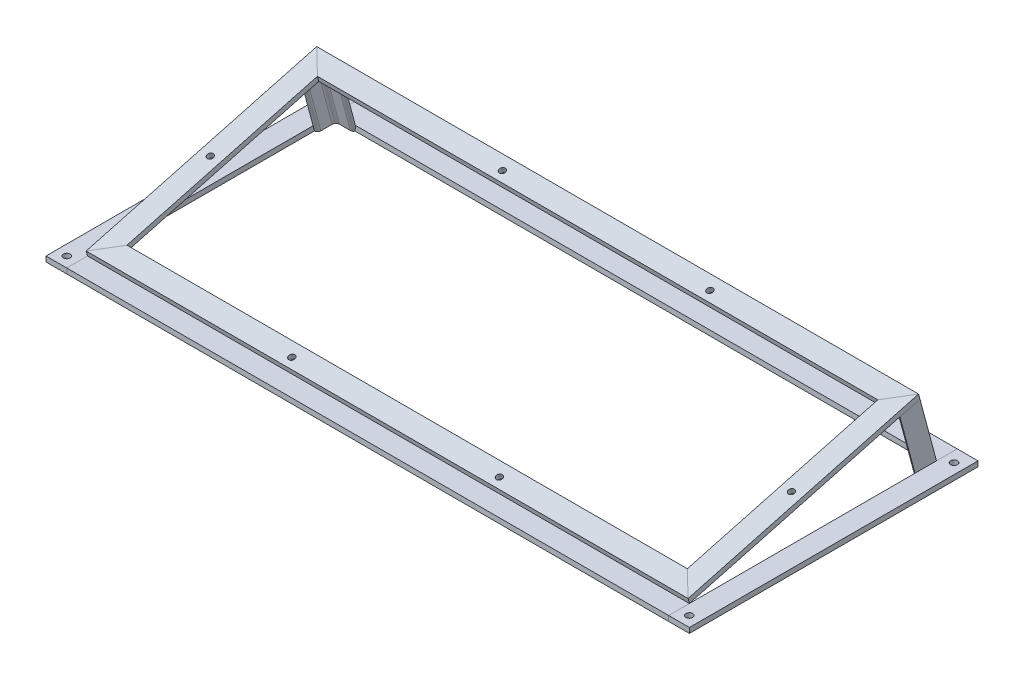
from build123d import *

# Parameters (mm, degrees)
TUBE_RECTANGULAR_50_X_30_X_2_6_46_DEPTH      = 251.615528128
TUBE_RECTANGULAR_50_X_30_X_2_6_46_DEPTH_BACK = 21.615528128
SKETCH1_W                                    = 20
SKETCH1_H                                    = 5
SKETCH1_ON_SEGMENT_2_W                       = 20
SKETCH1_ON_SEGMENT_2_H                       = 5
TUBE_RECTANGULAR_50_X_30_X_2_6_46_3_DEPTH    = 623.231056256
SKETCH1_ON_SEGMENT_3_W                       = 20
SKETCH1_ON_SEGMENT_3_H                       = 5
TUBE_RECTANGULAR_50_X_30_X_2_6_46_5_DEPTH    = 273.231056256
SKETCH1_ON_SEGMENT_4_W                       = 20
SKETCH1_ON_SEGMENT_4_H                       = 5
TUBE_RECTANGULAR_50_X_30_X_2_6_46_7_DEPTH    = 623.231056256
L_ANGLE_EQUAL_20X20X3_13_DEPTH               = 61.628314259
L_ANGLE_EQUAL_20X20X3_13_2_DEPTH             = 61.628314259
TUBE_START                                   = -5
TUBE_RECTANGULAR_50_X_30_X_2_6_47_OUTL_W     = 20
TUBE_RECTANGULAR_50_X_30_X_2_6_47_OUTL_H     = 278.113521494
TUBE_RECTANGULAR_50_X_30_X_2_6_47_DEPTH      = 5
TUBE_START_2                                 = -290
TUBE_RECTANGULAR_50_X_30_X_2_6_47_2_OU_W     = 5
TUBE_RECTANGULAR_50_X_30_X_2_6_47_2_OU_H     = 20
TUBE_RECTANGULAR_50_X_30_X_2_6_47_2_DEPTH    = 580
TUBE_RECTANGULAR_50_X_30_X_2_6_47_3_OU_W     = 5
TUBE_RECTANGULAR_50_X_30_X_2_6_47_3_OU_H     = 20
TUBE_RECTANGULAR_50_X_30_X_2_6_47_3_DEPTH    = 580
TUBE_RECTANGULAR_50_X_30_X_2_6_47_4_OU_W     = 20
TUBE_RECTANGULAR_50_X_30_X_2_6_47_4_OU_H     = 278.113521494
TUBE_RECTANGULAR_50_X_30_X_2_6_47_4_DEPTH    = 5
BODY_START                                   = 61.628314241
BODY_5_RUN_ON_DEPTH                          = 5.176381
BODY_START_2                                 = 61.62831424
BODY_6_RUN_ON_DEPTH                          = 5.176381
SKETCH20_W                                   = 3.3
SKETCH20_H                                   = 5
M6_CLEARANCE_HOLE1_AT_2_COUNT                = 2
M6_CLEARANCE_HOLE1_AT_2_PITCH                = 255
M6_CLEARANCE_HOLE1_AT_3_COUNT                = 2
M6_CLEARANCE_HOLE1_AT_3_PITCH                = 651.939414363
M6_CLEARANCE_HOLE1_AT_4_COUNT                = 2
M6_CLEARANCE_HOLE1_AT_4_PITCH                = 600
ESQUISSE2_W                                  = 2.9
ESQUISSE2_H                                  = 76.634324293
D_GAGEMENT_M51_AT_2_COUNT                    = 2
D_GAGEMENT_M51_AT_2_PITCH                    = 290
D_GAGEMENT_M51_AT_3_COUNT                    = 2
D_GAGEMENT_M51_AT_3_PITCH                    = 210
D_GAGEMENT_M51_AT_4_COUNT                    = 2
D_GAGEMENT_M51_AT_4_PITCH                    = 208.386659842
D_GAGEMENT_M51_AT_5_COUNT                    = 2
D_GAGEMENT_M51_AT_5_PITCH                    = 394.239774756
D_GAGEMENT_M51_AT_6_COUNT                    = 2
D_GAGEMENT_M51_AT_6_PITCH                    = 200


# Read off the part's stored shape, not the designer's step: Tube (rectangular) 50 X 30 X 2.6(47)
with BuildPart() as part:
    # Sketch1 → Tube (rectangular) 50 X 30 X 2.6(46) (new, two sides: drawn at the far end of the back side and taken through both)
    with BuildSketch(Plane(origin=(-280, 2.414814566, 119.70380836), x_dir=(1, 0, 0), z_dir=(1.2067641572012591e-15, 0.25881904510252146, -0.9659258262890681)).offset(-TUBE_RECTANGULAR_50_X_30_X_2_6_46_DEPTH_BACK)):
        Rectangle(SKETCH1_W, SKETCH1_H)
    extrude(amount=TUBE_RECTANGULAR_50_X_30_X_2_6_46_DEPTH + TUBE_RECTANGULAR_50_X_30_X_2_6_46_DEPTH_BACK)

    # Tube (rectangular) 50 X 30 X 2.6(46) mitr
    split(bisect_by=Plane(origin=(-290, 0, 119.056760747), x_dir=(-0.250562807, -0.968100346, 0), z_dir=(-0.707106781, 0.183012702, -0.683012702)), keep=Keep.TOP)

    # Tube (rectangular) 50 X 30 X 2.6(46)  2
    split(bisect_by=Plane(origin=(-290, 59.528380374, -103.106179299), x_dir=(0.250562807, -0.968100346, 0), z_dir=(-0.707106781, -0.183012702, 0.683012702)), keep=Keep.TOP)


with BuildPart() as body_2:
    # Sketch1 on segment 2 (carried to segment 2) → Tube (rectangular) 50 X 30 X 2.6(46)  3 (new body)
    with BuildSketch(Plane(origin=(-311.615528128, 59.355004488, -92.799873424), x_dir=(0, -0.258819045, 0.965925826), z_dir=(1, 0, 0))):
        Rectangle(SKETCH1_ON_SEGMENT_2_W, SKETCH1_ON_SEGMENT_2_H)
    extrude(amount=TUBE_RECTANGULAR_50_X_30_X_2_6_46_3_DEPTH)

    # Tube _rectangular_ 50 X 30 X 2.6_46 3 mi
    split(bisect_by=Plane(origin=(-290, 59.528380374, -103.106179299), x_dir=(-0.250562807, 0.968100346, 0), z_dir=(0.707106781, 0.183012702, -0.683012702)), keep=Keep.TOP)

    # Tube (rectangular) 50 X 30 X 2.6(46)  4
    split(bisect_by=Plane(origin=(290, 59.528380374, -103.106179299), x_dir=(-0.250562807, -0.968100346, 0), z_dir=(-0.707106781, 0.183012702, -0.683012702)), keep=Keep.TOP)


with BuildPart() as body_3:
    # Sketch1 on segment 3 (carried to segment 3) → Tube (rectangular) 50 X 30 X 2.6(46)  5 (new body)
    with BuildSketch(Plane(origin=(280, 67.537705289, -123.338128554), x_dir=(-1, 0, 0), z_dir=(0, -0.258819045, 0.965925826))):
        Rectangle(SKETCH1_ON_SEGMENT_3_W, SKETCH1_ON_SEGMENT_3_H)
    extrude(amount=TUBE_RECTANGULAR_50_X_30_X_2_6_46_5_DEPTH)

    # Tube _rectangular_ 50 X 30 X 2.6_46 5 mi
    split(bisect_by=Plane(origin=(290, 59.528380374, -103.106179299), x_dir=(0.250562807, 0.968100346, 0), z_dir=(0.707106781, -0.183012702, 0.683012702)), keep=Keep.TOP)

    # Tube (rectangular) 50 X 30 X 2.6(46)  6
    split(bisect_by=Plane(origin=(290, 0, 119.056760747), x_dir=(-0.250562807, 0.968100346, 0), z_dir=(0.707106781, 0.183012702, -0.683012702)), keep=Keep.TOP)


with BuildPart() as body_4:
    # Sketch1 on segment 4 (carried to segment 4) → Tube (rectangular) 50 X 30 X 2.6(46)  7 (new body)
    with BuildSketch(Plane(origin=(311.615528128, 5.003005017, 110.044550097), x_dir=(0, 0.258819045, -0.965925826), z_dir=(-1, 0, 0))):
        Rectangle(SKETCH1_ON_SEGMENT_4_W, SKETCH1_ON_SEGMENT_4_H)
    extrude(amount=TUBE_RECTANGULAR_50_X_30_X_2_6_46_7_DEPTH)

    # Tube _rectangular_ 50 X 30 X 2.6_46 7 mi
    split(bisect_by=Plane(origin=(-290, 0, 119.056760747), x_dir=(0.250562807, 0.968100346, 0), z_dir=(0.707106781, -0.183012702, 0.683012702)), keep=Keep.TOP)

    # Tube (rectangular) 50 X 30 X 2.6(46)  8
    split(bisect_by=Plane(origin=(290, 0, 119.056760747), x_dir=(0.250562807, -0.968100346, 0), z_dir=(-0.707106781, -0.183012702, 0.683012702)), keep=Keep.TOP)

    # Esquisse2 → Dégagement M51 (revolve, cut)
    with BuildSketch(Plane(origin=(100, 7.029591015, 112.140486449), x_dir=(0, -0.2588190451025213, 0.9659258262890682), z_dir=(1, 0, 0))):
        with Locations((1.45, 38.317162147)):
            Rectangle(ESQUISSE2_W, ESQUISSE2_H)
    d_gagement_m51 = revolve(axis=Axis((100, 13.163220012, 113.783987386), (-9.20037838079571e-15, -0.9659258262890682, -0.25881904510252135)), mode=Mode.SUBTRACT)

    # Dégagement M51 at 6: Dégagement M51 ×2
    with Locations(*[(-i * D_GAGEMENT_M51_AT_6_PITCH, 0, 0) for i in range(1, D_GAGEMENT_M51_AT_6_COUNT)]):
        add(d_gagement_m51, mode=Mode.SUBTRACT)


with BuildPart() as body_5:
    # Sketch13 → L angle (equal) 20X20X3(13) (new body)
    with BuildSketch(Plane(origin=(-290, 59.528380374, -103.106179299), x_dir=(1, 0, 0), z_dir=(0, -0.9659258262890681, -0.25881904510252174))):
        with BuildLine():
            Line((0, 20), (0, 0))
            Line((0, 0), (20, 0))
            ThreePointArc((20, 0), (19.121320344, 2.121320344), (17, 3))
            Line((17, 3), (6.5, 3))
            ThreePointArc((6.5, 3), (4.025126266, 4.025126266), (3, 6.5))
            Line((3, 6.5), (3, 17))
            ThreePointArc((3, 17), (2.121320344, 19.121320344), (0, 20))
        make_face()
    extrude(amount=L_ANGLE_EQUAL_20X20X3_13_DEPTH)

    # Sketch13 → body 5 run on (add)
    with BuildSketch(Plane(origin=(-290, 59.528380374, -103.106179299), x_dir=(1, 0, 0), z_dir=(0, -0.9659258262890681, -0.25881904510252174)).offset(BODY_START)):
        with BuildLine():
            Line((0, 20), (0, 0))
            Line((0, 0), (20, 0))
            ThreePointArc((20, 0), (19.121320344, 2.121320344), (17, 3))
            Line((17, 3), (6.5, 3))
            ThreePointArc((6.5, 3), (4.025126266, 4.025126266), (3, 6.5))
            Line((3, 6.5), (3, 17))
            ThreePointArc((3, 17), (2.121320344, 19.121320344), (0, 20))
        make_face()
    extrude(amount=BODY_5_RUN_ON_DEPTH)

    # Trim_Extend3 2
    split(bisect_by=Plane(origin=(-300, -5, 0), x_dir=(-1, 0, 0), z_dir=(0, 1, 0)), keep=Keep.TOP)

    # Trim/Extend5
    split(bisect_by=Plane(origin=(0, -2.5, -119.056760747), x_dir=(0, -1, 0), z_dir=(0, 0, 1)), keep=Keep.TOP)


with BuildPart() as body_6:
    # Sketch13 on segment 2 (carried to segment 2) → L angle _equal_ 20X20X3_13 2 (new body)
    with BuildSketch(Plane(origin=(290, 59.528380374, -103.106179299), x_dir=(0, -0.258819045, 0.965925826), z_dir=(0, -0.965925826, -0.258819045))):
        with BuildLine():
            Line((0, 20), (0, 0))
            Line((0, 0), (20, 0))
            ThreePointArc((20, 0), (19.121320344, 2.121320344), (17, 3))
            Line((17, 3), (6.5, 3))
            ThreePointArc((6.5, 3), (4.025126266, 4.025126266), (3, 6.5))
            Line((3, 6.5), (3, 17))
            ThreePointArc((3, 17), (2.121320344, 19.121320344), (0, 20))
        make_face()
    extrude(amount=L_ANGLE_EQUAL_20X20X3_13_2_DEPTH)

    # Sketch13 on segment 2 (carried to segment 2) → body 6 run on (add)
    with BuildSketch(Plane(origin=(290, 59.528380374, -103.106179299), x_dir=(0, -0.258819045, 0.965925826), z_dir=(0, -0.965925826, -0.258819045)).offset(BODY_START_2)):
        with BuildLine():
            Line((0, 20), (0, 0))
            Line((0, 0), (20, 0))
            ThreePointArc((20, 0), (19.121320344, 2.121320344), (17, 3))
            Line((17, 3), (6.5, 3))
            ThreePointArc((6.5, 3), (4.025126266, 4.025126266), (3, 6.5))
            Line((3, 6.5), (3, 17))
            ThreePointArc((3, 17), (2.121320344, 19.121320344), (0, 20))
        make_face()
    extrude(amount=BODY_6_RUN_ON_DEPTH)

    # Trim_Extend3 2
    split(bisect_by=Plane(origin=(-300, -5, 0), x_dir=(-1, 0, 0), z_dir=(0, 1, 0)), keep=Keep.TOP)

    # Trim/Extend5
    split(bisect_by=Plane(origin=(0, -2.5, -119.056760747), x_dir=(0, -1, 0), z_dir=(0, 0, 1)), keep=Keep.TOP)


with BuildPart() as body_7:
    # Tube (rectangular) 50 X 30 X 2.6(47) outl → Tube (rectangular) 50 X 30 X 2.6(47) (new body)
    with BuildSketch(Plane(origin=(0, 0, 0), x_dir=(1, 0, 0), z_dir=(0, 1, 0)).offset(TUBE_START)):
        with Locations((-300, 0)):
            Rectangle(TUBE_RECTANGULAR_50_X_30_X_2_6_47_OUTL_W, TUBE_RECTANGULAR_50_X_30_X_2_6_47_OUTL_H)
    extrude(amount=TUBE_RECTANGULAR_50_X_30_X_2_6_47_DEPTH)


with BuildPart() as body_8:
    # Tube _rectangular_ 50 X 30 X 2.6_47 2 ou → Tube _rectangular_ 50 X 30 X 2.6_47 2 (new body)
    with BuildSketch(Plane.YZ.offset(TUBE_START_2)):
        with Locations((-2.5, 129.056760747)):
            Rectangle(TUBE_RECTANGULAR_50_X_30_X_2_6_47_2_OU_W, TUBE_RECTANGULAR_50_X_30_X_2_6_47_2_OU_H)
    extrude(amount=TUBE_RECTANGULAR_50_X_30_X_2_6_47_2_DEPTH)


with BuildPart() as body_9:
    # Tube _rectangular_ 50 X 30 X 2.6_47 3 ou → Tube _rectangular_ 50 X 30 X 2.6_47 3 (new body)
    with BuildSketch(Plane.YZ.offset(TUBE_START_2)):
        with Locations((-2.5, -129.056760747)):
            Rectangle(TUBE_RECTANGULAR_50_X_30_X_2_6_47_3_OU_W, TUBE_RECTANGULAR_50_X_30_X_2_6_47_3_OU_H)
    extrude(amount=TUBE_RECTANGULAR_50_X_30_X_2_6_47_3_DEPTH)


with BuildPart() as body_10:
    # Tube _rectangular_ 50 X 30 X 2.6_47 4 ou → Tube _rectangular_ 50 X 30 X 2.6_47 4 (new body)
    with BuildSketch(Plane(origin=(0, 0, 0), x_dir=(1, 0, 0), z_dir=(0, 1, 0)).offset(TUBE_START)):
        with Locations((300, 0)):
            Rectangle(TUBE_RECTANGULAR_50_X_30_X_2_6_47_4_OU_W, TUBE_RECTANGULAR_50_X_30_X_2_6_47_4_OU_H)
    extrude(amount=TUBE_RECTANGULAR_50_X_30_X_2_6_47_4_DEPTH)

    # Sketch20 → M6 Clearance Hole1 (revolve, cut)
    with BuildSketch(Plane(origin=(300, 0, -125.943239253), x_dir=(0, 0, 1), z_dir=(1, 0, 0))):
        with Locations((1.65, 2.5)):
            Rectangle(SKETCH20_W, SKETCH20_H)
    m6_clearance_hole1 = revolve(axis=Axis((300, 6.35, -125.943239253), (0, -1, 0)), mode=Mode.SUBTRACT)

    # M6 Clearance Hole1 at 2: M6 Clearance Hole1 ×2
    with Locations(*[(0, 0, i * M6_CLEARANCE_HOLE1_AT_2_PITCH) for i in range(1, M6_CLEARANCE_HOLE1_AT_2_COUNT)]):
        add(m6_clearance_hole1, mode=Mode.SUBTRACT)


with BuildPart() as body_7_1:
    add(body_7.part)

    # M6 Clearance Hole1 at 3: M6 Clearance Hole1 ×2
    with Locations(*[Vector(-0.9203309184584745, 9.61147403107494e-15, 0.3911406403448521) * (i * M6_CLEARANCE_HOLE1_AT_3_PITCH) for i in range(1, M6_CLEARANCE_HOLE1_AT_3_COUNT)]):
        add(m6_clearance_hole1, mode=Mode.SUBTRACT)

    # M6 Clearance Hole1 at 4: M6 Clearance Hole1 ×2
    with Locations(*[(-i * M6_CLEARANCE_HOLE1_AT_4_PITCH, 0, 0) for i in range(1, M6_CLEARANCE_HOLE1_AT_4_COUNT)]):
        add(m6_clearance_hole1, mode=Mode.SUBTRACT)


with BuildPart() as body_2_1:
    add(body_2.part)

    # Dégagement M51 at 2: Dégagement M51 ×2
    with Locations(*[Vector(-0.6896551724137929, 0.18742068783286647, -0.6994635293817376) * (i * D_GAGEMENT_M51_AT_2_PITCH) for i in range(1, D_GAGEMENT_M51_AT_2_COUNT)]):
        add(d_gagement_m51, mode=Mode.SUBTRACT)

    # Dégagement M51 at 3: Dégagement M51 ×2
    with Locations(*[Vector(-1.887261657944815e-15, 0.2588190451025214, -0.9659258262890681) * (i * D_GAGEMENT_M51_AT_3_PITCH) for i in range(1, D_GAGEMENT_M51_AT_3_COUNT)]):
        add(d_gagement_m51, mode=Mode.SUBTRACT)


with BuildPart() as body_3_1:
    add(body_3.part)

    # Dégagement M51 at 4: Dégagement M51 ×2
    with Locations(*[Vector(0.8637789008984335, 0.1304114176809645, -0.4867020366724752) * (i * D_GAGEMENT_M51_AT_4_PITCH) for i in range(1, D_GAGEMENT_M51_AT_4_COUNT)]):
        add(d_gagement_m51, mode=Mode.SUBTRACT)


with BuildPart() as part_1:
    add(part.part)

    # Dégagement M51 at 5: Dégagement M51 ×2
    with Locations(*[Vector(-0.963880420829616, 0.06893266858362566, -0.2572602214553631) * (i * D_GAGEMENT_M51_AT_5_PITCH) for i in range(1, D_GAGEMENT_M51_AT_5_COUNT)]):
        add(d_gagement_m51, mode=Mode.SUBTRACT)


solid = Compound([body_4.part, body_5.part, body_6.part, body_8.part, body_9.part, body_10.part, body_7_1.part, body_2_1.part, body_3_1.part, part_1.part])
